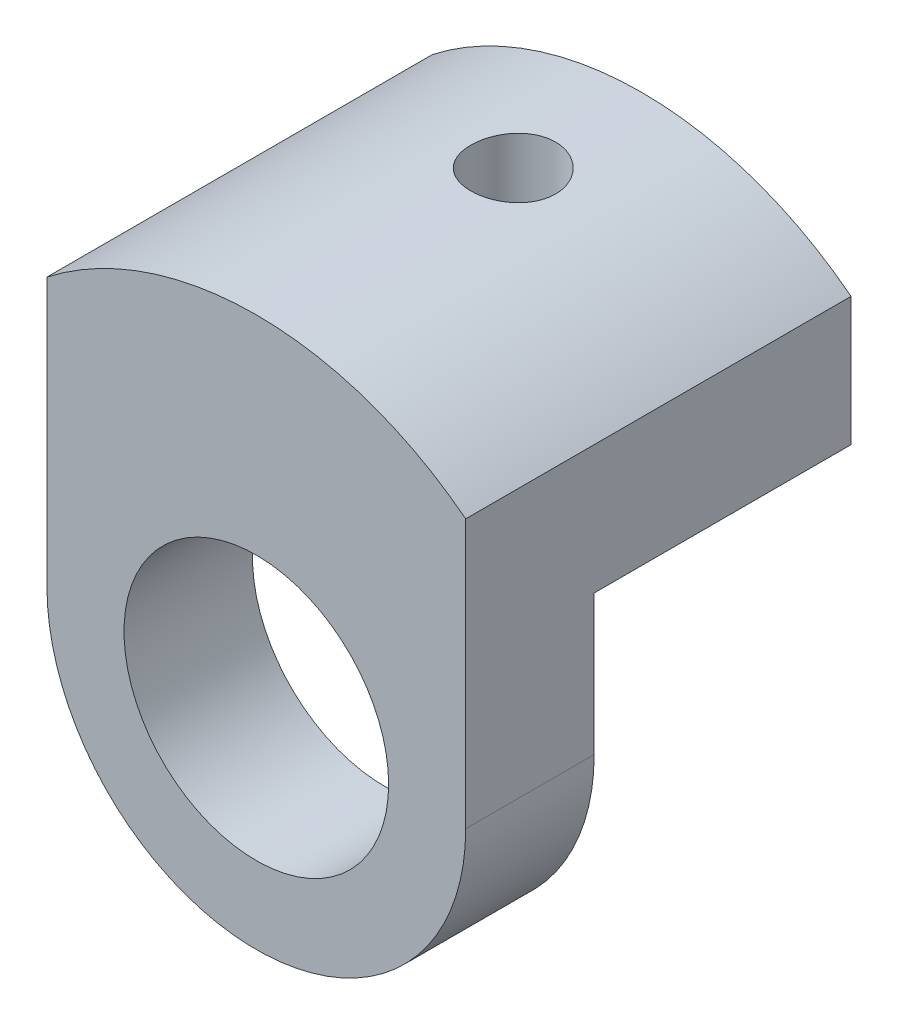
from build123d import *

# Parameters (mm, degrees)
SKETCH1_R           = 5.15
BOSS_EXTRUDE1_DEPTH = 5
BOSS_EXTRUDE2_START = 10
BOSS_EXTRUDE2_DEPTH = 10
SKETCH3_R           = 1.65
CUT_EXTRUDE1_DEPTH  = 10
CUT_EXTRUDE2_DEPTH  = 2.5


with BuildPart() as part:
    # Sketch1 → Boss-Extrude1 (new body)
    with BuildSketch(Plane.XY):
        with BuildLine():
            ThreePointArc((-8.15, 0), (0, -8.15), (8.15, 0))
            Line((8.15, 0), (8.15, 10.447009141))
            ThreePointArc((8.15, 10.447009141), (0, 13.25), (-8.15, 10.447009141))
            Line((-8.15, 10.447009141), (-8.15, 0))
        make_face()
        Circle(SKETCH1_R, mode=Mode.SUBTRACT)
    extrude(amount=BOSS_EXTRUDE1_DEPTH)

    # Sketch2 → Boss-Extrude2 (add)
    with BuildSketch(Plane(origin=(0, 0, 0), x_dir=(-1, 0, 0), z_dir=(0, 0, -1)).offset(BOSS_EXTRUDE2_START)):
        with BuildLine():
            ThreePointArc((8.15, 10.447009141), (0, 13.25), (-8.15, 10.447009141))
            Line((-8.15, 10.447009141), (-8.15, 5.447009141))
            Line((-8.15, 5.447009141), (8.15, 5.447009141))
            Line((8.15, 5.447009141), (8.15, 10.447009141))
        make_face()
    extrude(amount=-BOSS_EXTRUDE2_DEPTH)

    # Sketch3 → Cut-Extrude1 (cut)
    with BuildSketch(Plane.XZ.offset(-5.447009141)):
        with Locations((0, -5)):
            Circle(SKETCH3_R)
    extrude(amount=-CUT_EXTRUDE1_DEPTH, mode=Mode.SUBTRACT)

    # Sketch4 → Cut-Extrude2 (cut)
    with BuildSketch(Plane.XZ.offset(-5.447009141)):
        Polygon((3, -3.267949192), (0, -1.535898385), (-3, -3.267949192), (-3, -6.732050808), (0, -8.464101615), (3, -6.732050808), align=None)
    extrude(amount=-CUT_EXTRUDE2_DEPTH, mode=Mode.SUBTRACT)


solid = part.part
